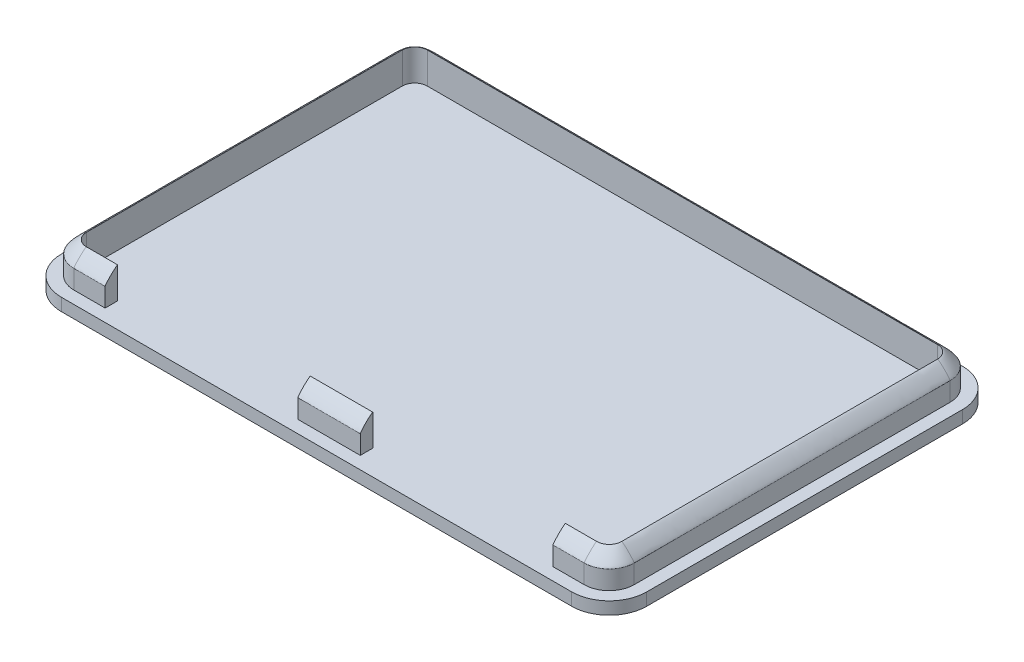
from build123d import *

# Parameters (mm, degrees)
SALIENTE_EXTRUIR1_DEPTH = 2
SALIENTE_EXTRUIR2_DEPTH = 5
REDONDEO1_SIZE          = 2
CROQUIS3_W              = 30.87
CROQUIS3_H              = 2
CORTAR_EXTRUIR1_DEPTH   = 8


with BuildPart() as part:
    # Croquis1 → Saliente-Extruir1 (new body)
    with BuildSketch(Plane(origin=(0, 0, 0), x_dir=(1, 0, 0), z_dir=(0, 1, 0))):
        with BuildLine():
            Line((-40.87, -31.3), (40.87, -31.3))
            ThreePointArc((40.87, -31.3), (45.112640687, -29.542640687), (46.87, -25.3))
            Line((46.87, -25.3), (46.87, 25.3))
            ThreePointArc((46.87, 25.3), (45.112640687, 29.542640687), (40.87, 31.3))
            Line((40.87, 31.3), (-40.87, 31.3))
            ThreePointArc((-40.87, 31.3), (-45.112640687, 29.542640687), (-46.87, 25.3))
            Line((-46.87, 25.3), (-46.87, -25.3))
            ThreePointArc((-46.87, -25.3), (-45.112640687, -29.542640687), (-40.87, -31.3))
        make_face()
    extrude(amount=SALIENTE_EXTRUIR1_DEPTH)

    # Croquis2 → Saliente-Extruir2 (add)
    with BuildSketch(Plane(origin=(0, 2, 0), x_dir=(1, 0, 0), z_dir=(0, 1, 0))):
        with BuildLine():
            Line((44.87, -25.3), (44.87, 25.3))
            ThreePointArc((44.87, 25.3), (43.698427125, 28.128427125), (40.87, 29.3))
            Line((40.87, 29.3), (-40.87, 29.3))
            ThreePointArc((-40.87, 29.3), (-43.698427125, 28.128427125), (-44.87, 25.3))
            Line((-44.87, 25.3), (-44.87, -25.3))
            ThreePointArc((-44.87, -25.3), (-43.698427125, -28.128427125), (-40.87, -29.3))
            Line((-40.87, -29.3), (40.87, -29.3))
            ThreePointArc((40.87, -29.3), (43.698427125, -28.128427125), (44.87, -25.3))
        make_face()
        with BuildLine():
            Line((42.87, -25.3), (42.87, 25.3))
            ThreePointArc((42.87, 25.3), (42.284213562, 26.714213562), (40.87, 27.3))
            Line((40.87, 27.3), (-40.87, 27.3))
            ThreePointArc((-40.87, 27.3), (-42.284213562, 26.714213562), (-42.87, 25.3))
            Line((-42.87, 25.3), (-42.87, -25.3))
            ThreePointArc((-42.87, -25.3), (-42.284213562, -26.714213562), (-40.87, -27.3))
            Line((-40.87, -27.3), (40.87, -27.3))
            ThreePointArc((40.87, -27.3), (42.284213562, -26.714213562), (42.87, -25.3))
        make_face(mode=Mode.SUBTRACT)
    extrude(amount=SALIENTE_EXTRUIR2_DEPTH)

    # Redondeo1
    # a fillet whose section is not a circle: 2 mm, written as the material it takes off along each edge
    with BuildSketch(Plane(origin=(40.87, 7, -29.3), x_dir=(0, -1, 0), z_dir=(-1, 0, 0)), Plane(origin=(-40.87, 7, 29.3), x_dir=(0, -1, 0), z_dir=(1, 0, 0))) as redondeo1_piece_1:
        with BuildLine():
            Bezier((REDONDEO1_SIZE, 0), (0, 0), (0, REDONDEO1_SIZE), weights=[1, 0.111111111, 1])
            Line((0, REDONDEO1_SIZE), (0, 0))
            Line((0, 0), (REDONDEO1_SIZE, 0))
        make_face()
    extrude(amount=81.74, mode=Mode.SUBTRACT)
    with BuildSketch(Plane(origin=(-40.87, 7, -25.3), x_dir=(0, 0, -1), z_dir=(1, 0, 0))) as redondeo1_piece_2:
        with BuildLine():
            Bezier((4, -REDONDEO1_SIZE), (4, 0), (4 - REDONDEO1_SIZE, 0), weights=[1, 0.111111111, 1])
            Line((4 - REDONDEO1_SIZE, 0), (4, 0))
            Line((4, 0), (4, -REDONDEO1_SIZE))
        make_face()
    revolve(axis=Axis((-40.87, 7, -25.3), (0, 1, 0)), revolution_arc=90, mode=Mode.SUBTRACT)
    with BuildSketch(Plane(origin=(40.87, 7, -25.3), x_dir=(1, 0, 0), z_dir=(0, 0, 1))) as redondeo1_piece_3:
        with BuildLine():
            Bezier((4, -REDONDEO1_SIZE), (4, 0), (4 - REDONDEO1_SIZE, 0), weights=[1, 0.111111111, 1])
            Line((4 - REDONDEO1_SIZE, 0), (4, 0))
            Line((4, 0), (4, -REDONDEO1_SIZE))
        make_face()
    revolve(axis=Axis((40.87, 7, -25.3), (0, 1, 0)), revolution_arc=90, mode=Mode.SUBTRACT)
    with BuildSketch(Plane(origin=(-44.87, 7, -25.3), x_dir=(0, -1, 0), z_dir=(0, 0, 1)), Plane(origin=(44.87, 7, 25.3), x_dir=(0, -1, 0), z_dir=(0, 0, -1))) as redondeo1_piece_4:
        with BuildLine():
            Bezier((REDONDEO1_SIZE, 0), (0, 0), (0, REDONDEO1_SIZE), weights=[1, 0.111111111, 1])
            Line((0, REDONDEO1_SIZE), (0, 0))
            Line((0, 0), (REDONDEO1_SIZE, 0))
        make_face()
    extrude(amount=50.6, mode=Mode.SUBTRACT)
    with BuildSketch(Plane(origin=(-40.87, 7, 25.3), x_dir=(-1, 0, 0), z_dir=(0, 0, -1))) as redondeo1_piece_5:
        with BuildLine():
            Bezier((4, -REDONDEO1_SIZE), (4, 0), (4 - REDONDEO1_SIZE, 0), weights=[1, 0.111111111, 1])
            Line((4 - REDONDEO1_SIZE, 0), (4, 0))
            Line((4, 0), (4, -REDONDEO1_SIZE))
        make_face()
    revolve(axis=Axis((-40.87, 7, 25.3), (0, 1, 0)), revolution_arc=90, mode=Mode.SUBTRACT)
    with BuildSketch(Plane(origin=(40.87, 7, 25.3), x_dir=(0, 0, 1), z_dir=(-1, 0, 0))) as redondeo1_piece_6:
        with BuildLine():
            Bezier((4, -REDONDEO1_SIZE), (4, 0), (4 - REDONDEO1_SIZE, 0), weights=[1, 0.111111111, 1])
            Line((4 - REDONDEO1_SIZE, 0), (4, 0))
            Line((4, 0), (4, -REDONDEO1_SIZE))
        make_face()
    revolve(axis=Axis((40.87, 7, 25.3), (0, 1, 0)), revolution_arc=90, mode=Mode.SUBTRACT)

    # Croquis3 → Cortar-Extruir1 (cut)
    with BuildSketch(Plane(origin=(0, 2, 0), x_dir=(1, 0, 0), z_dir=(0, 1, 0))):
        with Locations((-20.435, -28.3)):
            Rectangle(CROQUIS3_W, CROQUIS3_H)
        with Locations((20.435, -28.3)):
            Rectangle(CROQUIS3_W, CROQUIS3_H)
    extrude(amount=CORTAR_EXTRUIR1_DEPTH, mode=Mode.SUBTRACT)


solid = part.part
